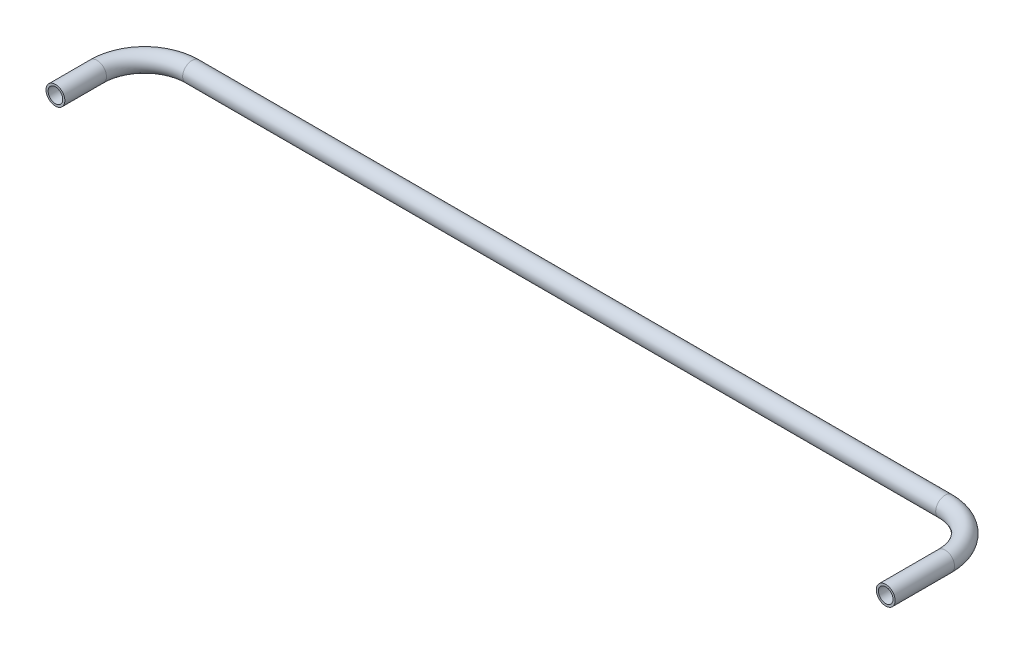
from build123d import *

# Parameters (mm, degrees)
SKETCH2_R   = 3.175
SKETCH2_R_2 = 2.4638


with BuildPart() as part:
    # Sweep-Thin1: sweep along a path in Sketch1
    with BuildLine(Plane(origin=(0, 0, 0), x_dir=(1, 0, 0), z_dir=(0, 1, 0))) as sweep_thin1_path:
        Line((0, 0), (0, 14))
        ThreePointArc((0, 14), (4.686291501, 25.313708499), (16, 30))
        Line((16, 30), (269.5, 30))
        ThreePointArc((269.5, 30), (280.813708499, 25.313708499), (285.5, 14))
        Line((285.5, 14), (285.5, -6))
    # Sketch2 → Sweep-Thin1 (sweep)
    with BuildSketch(Plane.XY):
        Circle(SKETCH2_R)
        Circle(SKETCH2_R_2, mode=Mode.SUBTRACT)
    sweep(path=sweep_thin1_path.line)


solid = part.part
